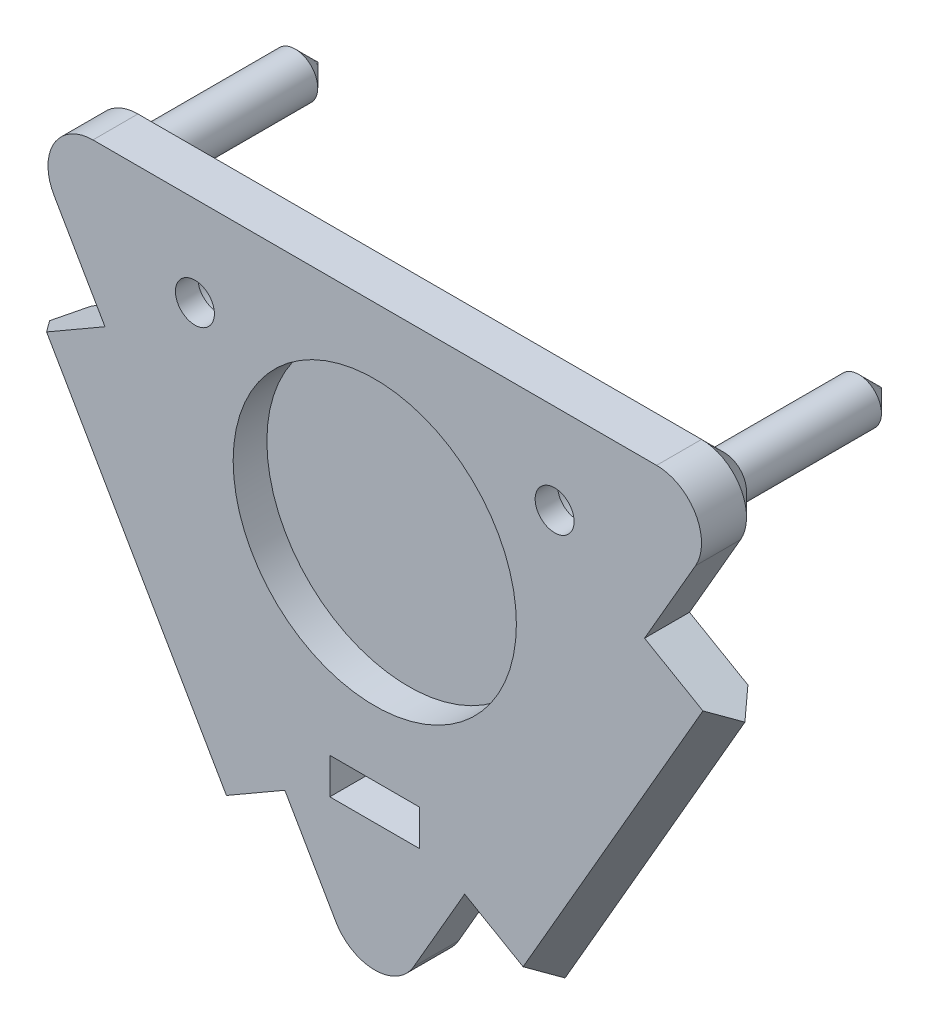
from build123d import *

# Parameters (mm, degrees)
BOSS_EXTRUDE1_DEPTH          = 3.175
FILLET1_R                    = 6.35
SKETCH3_R                    = 20
CUT_EXTRUDE1_DEPTH           = 4.7625
SKETCH8_R                    = 3.175
BOSS_EXTRUDE2_DEPTH          = 25.4
CHAMFER1_SIZE                = 3.175
CHAMFER2_SIZE                = 3.175
CIRPATTERN2_COUNT            = 3
CHAMFER1_OF_CIRPATTERN2_SIZE = 3.175
CHAMFER2_OF_CIRPATTERN2_SIZE = 3.175
SKETCH9_W                    = 12.7
SKETCH9_H                    = 5.08
CUT_EXTRUDE4_DEPTH           = 77.643529392
SKETCH10_R                   = 2.75
CUT_EXTRUDE5_DEPTH           = 77.643529392
SKETCH11_R                   = 5
CUT_EXTRUDE6_DEPTH           = 3.175
BOSS_EXTRUDE3_DEPTH          = 6.35
CHAMFER3_SIZE                = 3.175
CHAMFER3_OF_MIRROR2_SIZE     = 3.175


with BuildPart() as part:
    # Sketch1 → Boss-Extrude1 (new, symmetric)
    with BuildSketch(Plane.XY):
        Polygon((50.8, 29.329393675), (0, -58.65878735), (-50.8, 29.329393675), align=None)
    extrude(amount=BOSS_EXTRUDE1_DEPTH, both=True)

    # Fillet1
    fillet1_edges = [part.edges().sort_by_distance(p)[0] for p in [
        (50.8, 29.329393675, 0),
        (0, -58.65878735, 0),
        (-50.8, 29.329393675, 0),
    ]]
    fillet(fillet1_edges, radius=FILLET1_R)

    # Sketch3 → Cut-Extrude1 (cut)
    with BuildSketch(Plane.XY.offset(3.175)):
        Circle(SKETCH3_R)
    extrude(amount=-CUT_EXTRUDE1_DEPTH, mode=Mode.SUBTRACT)

    # Sketch8 → Boss-Extrude2 (add)
    with BuildSketch(Plane(origin=(0, 0, -3.175), x_dir=(-1, 0, 0), z_dir=(0, 0, -1))):
        with Locations((0, -45.95878735)):
            Circle(SKETCH8_R)
    boss_extrude2 = extrude(amount=BOSS_EXTRUDE2_DEPTH)

    # Chamfer1
    chamfer1_edges = [part.edges().sort_by_distance(p)[0] for p in [
        (3.175, -45.95878735, -3.175),
    ]]
    chamfer(chamfer1_edges, length=CHAMFER1_SIZE - 0.0001)  # a hair under: the kernel refuses the full size

    # Chamfer2
    chamfer2_edges = [part.edges().sort_by_distance(p)[0] for p in [
        (3.175, -45.95878735, -28.575),
    ]]
    chamfer(chamfer2_edges, length=CHAMFER2_SIZE - 0.0001)  # a hair under: the kernel refuses the full size

    # CirPattern2: Boss-Extrude2 ×3 about axis
    cirpattern2_axis = Axis((0, 0, 0), (0, 0, 1))
    for i in range(1, CIRPATTERN2_COUNT):
        add(boss_extrude2.rotate(cirpattern2_axis, i * 360 / CIRPATTERN2_COUNT))

    # Chamfer1 of CirPattern2
    chamfer1_of_cirpattern2_edges = [part.edges().sort_by_distance(p)[0] for p in [
        (38.213977372, 25.729024332, -3.175),
        (-41.388977372, 20.229763018, -3.175),
    ]]
    chamfer(chamfer1_of_cirpattern2_edges, length=CHAMFER1_OF_CIRPATTERN2_SIZE - 0.0001)  # a hair under: the kernel refuses the full size

    # Chamfer2 of CirPattern2
    chamfer2_of_cirpattern2_edges = [part.edges().sort_by_distance(p)[0] for p in [
        (38.213977372, 25.729024332, -28.575),
        (-41.388977372, 20.229763018, -28.575),
    ]]
    chamfer(chamfer2_of_cirpattern2_edges, length=CHAMFER2_OF_CIRPATTERN2_SIZE - 0.0001)  # a hair under: the kernel refuses the full size

    # Sketch9 → Cut-Extrude4 (cut, through all)
    with BuildSketch(Plane.XY.offset(3.175)):
        with Locations((0, -31.75)):
            Rectangle(SKETCH9_W, SKETCH9_H)
    extrude(amount=-CUT_EXTRUDE4_DEPTH, mode=Mode.SUBTRACT)

    # Sketch10 → Cut-Extrude5 (cut, through all)
    with BuildSketch(Plane.XY.offset(3.175)):
        with Locations((-25.4, 16.629393675)):
            Circle(SKETCH10_R)
        with Locations((25.4, 16.629393675)):
            Circle(SKETCH10_R)
    extrude(amount=-CUT_EXTRUDE5_DEPTH, mode=Mode.SUBTRACT)

    # Sketch11 → Cut-Extrude6 (cut)
    with BuildSketch(Plane(origin=(0, 0, -3.175), x_dir=(-1, 0, 0), z_dir=(0, 0, -1))):
        with Locations((-25.4, 16.629393675)):
            Circle(SKETCH11_R)
        with Locations((25.4, 16.629393675)):
            Circle(SKETCH11_R)
    extrude(amount=-CUT_EXTRUDE6_DEPTH, mode=Mode.SUBTRACT)

    # Sketch12 → Boss-Extrude3 (add)
    with BuildSketch(Plane.XY.offset(3.175)):
        Polygon((-49.098522628, 0.982348419), (-23.698522628, -43.011742094), (-12.7, -36.661742094), (-38.1, 7.332348419), align=None)
    boss_extrude3 = extrude(amount=-BOSS_EXTRUDE3_DEPTH)

    # Chamfer3
    chamfer3_edges = [part.edges().sort_by_distance(p)[0] for p in [
        (-36.398522628, -21.014696837, -3.175),
        (-36.398522628, -21.014696837, 3.175),
    ]]
    chamfer(chamfer3_edges, length=CHAMFER3_SIZE - 0.0001)  # a hair under: the kernel refuses the full size

    # Mirror2: Boss-Extrude3 across plane
    add(boss_extrude3.mirror(Plane(origin=(0, 0, 0), x_dir=(0, 0, 1), z_dir=(1, 0, 0))))

    # Chamfer3 of Mirror2
    chamfer3_of_mirror2_edges = [part.edges().sort_by_distance(p)[0] for p in [
        (36.398522628, -21.014696837, -3.175),
        (36.398522628, -21.014696837, 3.175),
    ]]
    chamfer(chamfer3_of_mirror2_edges, length=CHAMFER3_OF_MIRROR2_SIZE - 0.0001)  # a hair under: the kernel refuses the full size


solid = part.part
